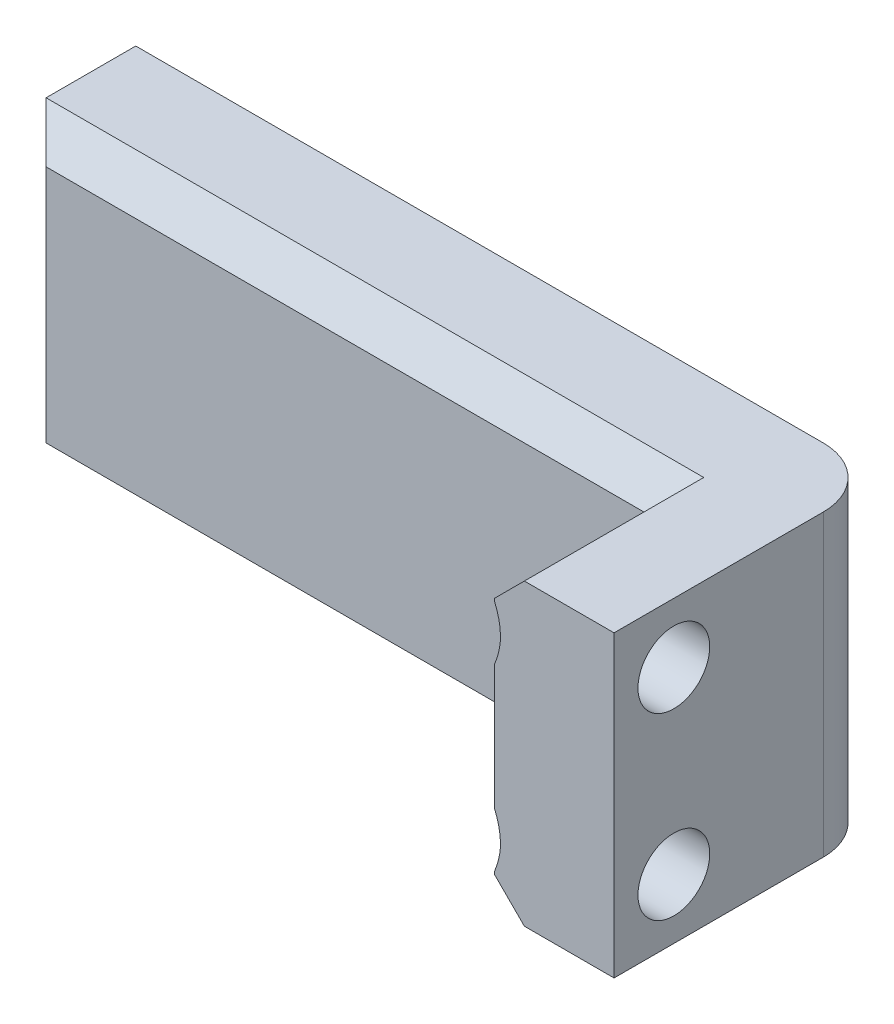
from build123d import *

# Parameters (mm, degrees)
ESBO_O1_W                                            = 25
ESBO_O1_H                                            = 14
RESSALTO_EXTRUS_O1_DEPTH                             = 4
ESBO_O2_W                                            = 4
ESBO_O2_H                                            = 14
RESSALTO_EXTRUS_O2_DEPTH                             = 5
ESBO_O4_W                                            = 25
ESBO_O4_H                                            = 2
CORTE_EXTRUS_O1_DEPTH                                = 31.033314835
ESCAREADO_PARA_PARAFUSO_COM_CABE_A_ESCAR_D           = 2.4
ESCAREADO_PARA_PARAFUSO_COM_CABE_A_ESCAR_DEPTH       = 15
ESCAREADO_PARA_PARAFUSO_COM_CABE_A_ESCAR_CSINK_D     = 4.4
ESCAREADO_PARA_PARAFUSO_COM_CABE_A_ESCAR_CSINK_ANGLE = 90
ESCAREADO_PARA_PARAFUSO_COM_CABE_A_ESCAR_TIP         = 0.721032743
FILETE1_R                                            = 2
CHANFRO1_SIZE                                        = 1


with BuildPart() as part:
    # Esboço1 → Ressalto-extrusão1 (new body)
    with BuildSketch(Plane.XY):
        with Locations((12.5, 7)):
            Rectangle(ESBO_O1_W, ESBO_O1_H)
    extrude(amount=RESSALTO_EXTRUS_O1_DEPTH)

    # Esboço2 → Ressalto-extrusão2 (add)
    with BuildSketch(Plane.XY.offset(4)):
        with Locations((23, 7)):
            Rectangle(ESBO_O2_W, ESBO_O2_H)
    extrude(amount=RESSALTO_EXTRUS_O2_DEPTH)

    # Esboço4 → Corte-extrusão1 (cut, through all)
    with BuildSketch(Plane.XY.offset(9)):
        with Locations((12.5, 13)):
            Rectangle(ESBO_O4_W, ESBO_O4_H)
        with Locations((12.5, 1)):
            Rectangle(ESBO_O4_W, ESBO_O4_H)
    extrude(amount=-CORTE_EXTRUS_O1_DEPTH, mode=Mode.SUBTRACT)

    # Escareado para parafuso com cabeça escareada chata de M21
    with Locations(Plane(origin=(21, 10, 7), x_dir=(0, -1, 0), z_dir=(-1, 0, 0))):
        with Locations((0, 0), (6, 0)):
            CounterSinkHole(ESCAREADO_PARA_PARAFUSO_COM_CABE_A_ESCAR_D / 2, ESCAREADO_PARA_PARAFUSO_COM_CABE_A_ESCAR_CSINK_D / 2, depth=ESCAREADO_PARA_PARAFUSO_COM_CABE_A_ESCAR_DEPTH, counter_sink_angle=ESCAREADO_PARA_PARAFUSO_COM_CABE_A_ESCAR_CSINK_ANGLE)
            with Locations((0, 0, -(ESCAREADO_PARA_PARAFUSO_COM_CABE_A_ESCAR_DEPTH + ESCAREADO_PARA_PARAFUSO_COM_CABE_A_ESCAR_TIP / 2))):  # 118° drill point
                Cone(0, ESCAREADO_PARA_PARAFUSO_COM_CABE_A_ESCAR_D / 2, ESCAREADO_PARA_PARAFUSO_COM_CABE_A_ESCAR_TIP, mode=Mode.SUBTRACT)

    # Filete1
    filete1_edges = [part.edges().sort_by_distance(p)[0] for p in [
        (25, 7, 0),
    ]]
    fillet(filete1_edges, radius=FILETE1_R)

    # Chanfro1
    # the kernel refuses this chamfer: 1 mm, written as the material it takes off along each edge
    with BuildSketch(Plane(origin=(0, 14.571682988, 4), x_dir=(-0.027495876610586365, 0, -0.9996219169112968), z_dir=(0, -1, 0))) as chanfro1_piece_1:
        Polygon((CHANFRO1_SIZE * 0.999621916911, CHANFRO1_SIZE * 0.0274958766106), (-CHANFRO1_SIZE * 0.0274958766106, CHANFRO1_SIZE * 0.999621916911), (0, 0), align=None)
    extrude(amount=15.143365976, mode=Mode.SUBTRACT)
    with BuildSketch(Plane(origin=(21, 12, 4), x_dir=(0, 0.02749587661058735, -0.9996219169112968), z_dir=(-1, 0, 0))) as chanfro1_piece_2:
        Polygon((CHANFRO1_SIZE * 0.999621916911, CHANFRO1_SIZE * 0.0274958766106), (-CHANFRO1_SIZE * 0.0274958766106, CHANFRO1_SIZE * 0.999621916911), (0, 0), align=None)
    extrude(amount=23.571682988, mode=Mode.SUBTRACT)
    with BuildSketch(Plane(origin=(21, 12, 5.344832151), x_dir=(0.9996219169112968, 0.027495876610585647, 0), z_dir=(0, 0, 1)), Plane(origin=(21, 2, 11.571682988), x_dir=(0.9996219169112968, -0.027495876610586726, 0), z_dir=(0, 0, -1))) as chanfro1_piece_3:
        Polygon((CHANFRO1_SIZE * 0.999621916911, -CHANFRO1_SIZE * 0.0274958766106), (-CHANFRO1_SIZE * 0.0274958766106, -CHANFRO1_SIZE * 0.999621916911), (0, 0), align=None)
    extrude(amount=6.226850837, mode=Mode.SUBTRACT)
    with BuildSketch(Plane(origin=(-2.571682988, 2, 4), x_dir=(0, 0.9996219169112968, 0.027495876610586487), z_dir=(1, 0, 0))) as chanfro1_piece_4:
        Polygon((CHANFRO1_SIZE * 0.999621916911, -CHANFRO1_SIZE * 0.0274958766106), (-CHANFRO1_SIZE * 0.0274958766106, -CHANFRO1_SIZE * 0.999621916911), (0, 0), align=None)
    extrude(amount=23.571682988, mode=Mode.SUBTRACT)
    with BuildSketch(Plane(origin=(21, 2, 8.655167849), x_dir=(-0.027495876610585623, 0.9996219169112968, 0), z_dir=(0, 0, -1))) as chanfro1_piece_5:
        Polygon((CHANFRO1_SIZE * 0.999621916911, CHANFRO1_SIZE * 0.0274958766106), (-CHANFRO1_SIZE * 0.0274958766106, CHANFRO1_SIZE * 0.999621916911), (0, 0), align=None)
    extrude(amount=4.655167849, mode=Mode.SUBTRACT)
    with BuildSketch(Plane(origin=(21, 12, 4), x_dir=(0.9996219169112968, 0.027495876610585647, 0), z_dir=(0, 0, 1))) as chanfro1_piece_6:
        Polygon((CHANFRO1_SIZE * 0.999621916911, -CHANFRO1_SIZE * 0.0274958766106), (-CHANFRO1_SIZE * 0.0274958766106, -CHANFRO1_SIZE * 0.999621916911), (0, 0), align=None)
    extrude(amount=4.655167849, mode=Mode.SUBTRACT)
    with BuildSketch(Plane(origin=(23.571682988, 12, 4), x_dir=(0, 0.027495876610585623, -0.9996219169112968), z_dir=(-1, 0, 0))) as chanfro1_piece_7a_section:
        Polygon((CHANFRO1_SIZE * 0.999621916911, CHANFRO1_SIZE * 0.0274958766106), (-CHANFRO1_SIZE * 0.0274958766106, CHANFRO1_SIZE * 0.999621916911), (0, 0), align=None)
    chanfro1_piece_7a = extrude(amount=26.143365976, mode=Mode.PRIVATE)
    chanfro1_piece_7a = split(chanfro1_piece_7a, bisect_by=Plane(origin=(21, 11.670206373, 3.670206373), z_dir=(1, 0, 0)), keep=Keep.TOP, mode=Mode.PRIVATE)
    with BuildSketch(Plane(origin=(21, 12, 1.428317012), x_dir=(0.9996219169112968, 0.027495876610585647, 0), z_dir=(0, 0, 1))) as chanfro1_piece_7b_section:
        Polygon((CHANFRO1_SIZE * 0.999621916911, -CHANFRO1_SIZE * 0.0274958766106), (-CHANFRO1_SIZE * 0.0274958766106, -CHANFRO1_SIZE * 0.999621916911), (0, 0), align=None)
    chanfro1_piece_7b = extrude(amount=7.226850837, mode=Mode.PRIVATE)
    chanfro1_piece_7b = split(chanfro1_piece_7b, bisect_by=Plane(origin=(21.329793627, 11.670206373, 4), z_dir=(0, 0, -1)), keep=Keep.TOP, mode=Mode.PRIVATE)
    chanfro1_piece_7 = chanfro1_piece_7a & chanfro1_piece_7b
    add(chanfro1_piece_7, mode=Mode.SUBTRACT)
    with BuildSketch(Plane(origin=(-2.571682988, 2, 4), x_dir=(0, 0.9996219169112968, 0.027495876610586487), z_dir=(1, 0, 0))) as chanfro1_piece_8a_section:
        Polygon((CHANFRO1_SIZE * 0.999621916911, -CHANFRO1_SIZE * 0.0274958766106), (-CHANFRO1_SIZE * 0.0274958766106, -CHANFRO1_SIZE * 0.999621916911), (0, 0), align=None)
    chanfro1_piece_8a = extrude(amount=26.143365976, mode=Mode.PRIVATE)
    chanfro1_piece_8a = split(chanfro1_piece_8a, bisect_by=Plane(origin=(21, 2.329793627, 3.670206373), z_dir=(1, 0, 0)), keep=Keep.TOP, mode=Mode.PRIVATE)
    with BuildSketch(Plane(origin=(21, 2, 8.655167849), x_dir=(-0.027495876610585623, 0.9996219169112968, 0), z_dir=(0, 0, -1))) as chanfro1_piece_8b_section:
        Polygon((CHANFRO1_SIZE * 0.999621916911, CHANFRO1_SIZE * 0.0274958766106), (-CHANFRO1_SIZE * 0.0274958766106, CHANFRO1_SIZE * 0.999621916911), (0, 0), align=None)
    chanfro1_piece_8b = extrude(amount=7.226850837, mode=Mode.PRIVATE)
    chanfro1_piece_8b = split(chanfro1_piece_8b, bisect_by=Plane(origin=(21.329793627, 2.329793627, 4), z_dir=(0, 0, -1)), keep=Keep.TOP, mode=Mode.PRIVATE)
    chanfro1_piece_8 = chanfro1_piece_8a & chanfro1_piece_8b
    add(chanfro1_piece_8, mode=Mode.SUBTRACT)


solid = part.part
